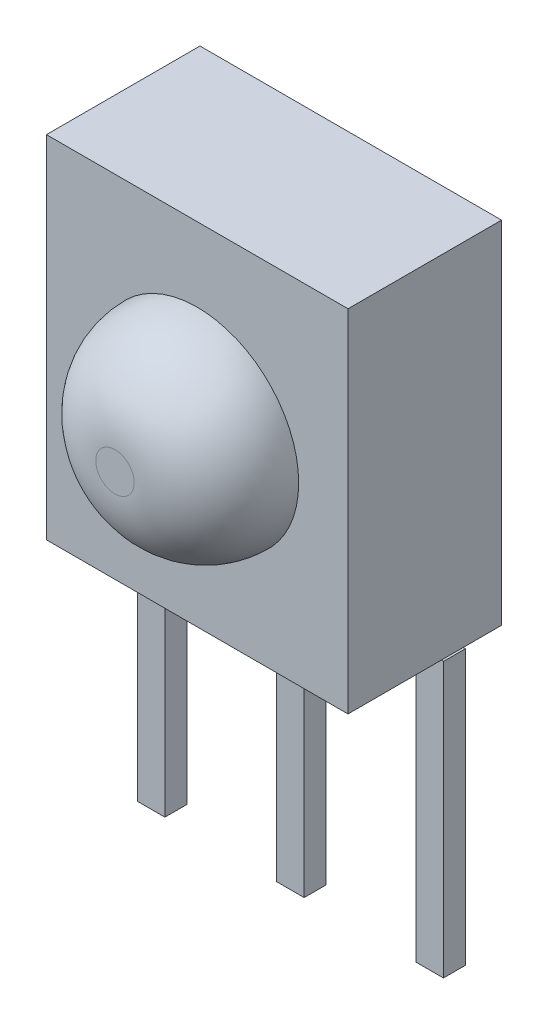
from build123d import *

# Parameters (mm, degrees)
SKETCH_1_W        = 5.5
SKETCH_1_H        = 6.4
EXTRUDE_1_DEPTH   = 2.8
SKETCH_3_R        = 1.85
EXTRUDE_2_DEPTH   = 1.5
FILLET_1_R        = 1.5
SKETCH_2_W        = 0.5
SKETCH_2_H        = 0.4
EXTRUDE_3_DEPTH   = 5
EXTRUDE_3_2_DEPTH = 5
EXTRUDE_3_3_DEPTH = 5


with BuildPart() as part:
    # 草图1 → 凸台-拉伸1 (new body)
    with BuildSketch(Plane.XY):
        Rectangle(SKETCH_1_W, SKETCH_1_H)
    extrude(amount=EXTRUDE_1_DEPTH)

    # 草图3 → 凸台-拉伸2 (add)
    with BuildSketch(Plane.XY.offset(2.8)):
        Circle(SKETCH_3_R)
    extrude(amount=EXTRUDE_2_DEPTH)

    # 圆角1
    fillet_1_edges = [part.edges().sort_by_distance(p)[0] for p in [
        (-1.85, 0, 4.3),
    ]]
    fillet(fillet_1_edges, radius=FILLET_1_R - 0.0001)  # a hair under: the kernel refuses the full size


with BuildPart() as body_2:
    # 草图2 → 凸台-拉伸3 (new body)
    with BuildSketch(Plane.XZ.offset(3.2)):
        with Locations((0, 0.9)):
            Rectangle(SKETCH_2_W, SKETCH_2_H)
    extrude(amount=EXTRUDE_3_DEPTH)


with BuildPart() as body_3:
    # 草图2 → Extrude 3 2 (new body)
    with BuildSketch(Plane.XZ.offset(3.2)):
        with Locations((-2.54, 0.9)):
            Rectangle(SKETCH_2_W, SKETCH_2_H)
    extrude(amount=EXTRUDE_3_2_DEPTH)


with BuildPart() as body_4:
    # 草图2 → Extrude 3 3 (new body)
    with BuildSketch(Plane.XZ.offset(3.2)):
        with Locations((2.54, 0.9)):
            Rectangle(SKETCH_2_W, SKETCH_2_H)
    extrude(amount=EXTRUDE_3_3_DEPTH)


solid = Compound([part.part, body_2.part, body_3.part, body_4.part])
